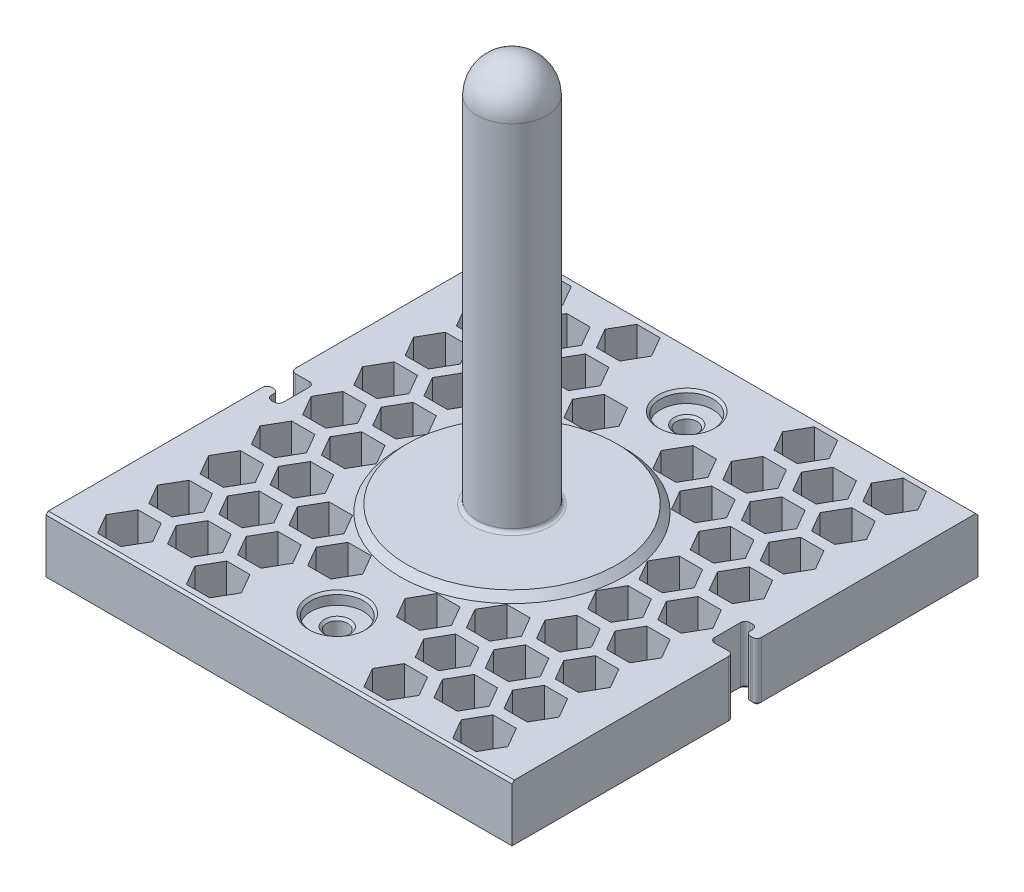
from build123d import *

# Parameters (mm, degrees)
SKETCH1_W           = 200
SKETCH1_H           = 200
BOSS_EXTRUDE1_DEPTH = 25
SKETCH2_R           = 15
BOSS_EXTRUDE2_DEPTH = 170
CUT_EXTRUDE3_REACH  = 242.884
FILLET2_R           = 2
FILLET3_R           = 15
SKETCH4_R           = 45
BOSS_EXTRUDE3_DEPTH = 3
CHAMFER1_SIZE       = 3
FILLET4_R           = 1.5
SKETCH5_R           = 4.5
CUT_EXTRUDE4_DEPTH  = 222.133443875
SKETCH8_R           = 11.25
CUT_EXTRUDE6_DEPTH  = 5
CHAMFER3_SIZE       = 1
FILL_PATTERN1_DEPTH = 25
CHAMFER4_SIZE       = 1


# Read off the part's stored shape, not the designer's step: Fill Pattern1
with BuildPart() as part:
    # Sketch1 → Boss-Extrude1 (new body)
    with BuildSketch(Plane(origin=(0, 0, 0), x_dir=(1, 0, 0), z_dir=(0, 1, 0))):
        Rectangle(SKETCH1_W, SKETCH1_H)
    extrude(amount=BOSS_EXTRUDE1_DEPTH)

    # Sketch2 → Boss-Extrude2 (add)
    with BuildSketch(Plane(origin=(0, 25, 0), x_dir=(1, 0, 0), z_dir=(0, 1, 0))):
        with Locations(Location((0, 0, 0), (0, 0, 270))):
            Circle(SKETCH2_R)
    extrude(amount=BOSS_EXTRUDE2_DEPTH)

    # Sketch3 → Cut-Extrude3 (cut, up to next)
    with BuildSketch(Plane(origin=(0, 0, 0), x_dir=(1, 0, 0), z_dir=(0, 1, 0)), mode=Mode.PRIVATE) as cut_extrude3_sk1:
        with BuildLine():
            Line((-100, 5.1), (-92, 5.1))
            ThreePointArc((-92, 5.1), (-90.585786438, 4.514213562), (-90, 3.1))
            Line((-90, 3.1), (-90, -8.1))
            ThreePointArc((-90, -8.1), (-90.585786438, -9.514213562), (-92, -10.1))
            Line((-92, -10.1), (-93.2, -10.1))
            ThreePointArc((-93.2, -10.1), (-94.614213562, -9.514213562), (-95.2, -8.1))
            Line((-95.2, -8.1), (-95.2, -7.1))
            ThreePointArc((-95.2, -7.1), (-95.785786438, -5.685786438), (-97.2, -5.1))
            Line((-97.2, -5.1), (-100, -5.1))
            Line((-100, -5.1), (-100, 5.1))
        make_face()
    cut_extrude3_tool1 = extrude(cut_extrude3_sk1.sketch, amount=CUT_EXTRUDE3_REACH, mode=Mode.PRIVATE) & part.part
    # Sketch3 → Cut-Extrude3 (cut, up to next)
    with BuildSketch(Plane(origin=(0, 0, 0), x_dir=(1, 0, 0), z_dir=(0, 1, 0)), mode=Mode.PRIVATE) as cut_extrude3_sk2:
        with BuildLine():
            Line((100, -5.1), (92, -5.1))
            ThreePointArc((92, -5.1), (90.585786438, -4.514213562), (90, -3.1))
            Line((90, -3.1), (90, 8.1))
            ThreePointArc((90, 8.1), (90.585786438, 9.514213562), (92, 10.1))
            Line((92, 10.1), (93.2, 10.1))
            ThreePointArc((93.2, 10.1), (94.614213562, 9.514213562), (95.2, 8.1))
            Line((95.2, 8.1), (95.2, 7.1))
            ThreePointArc((95.2, 7.1), (95.785786438, 5.685786438), (97.2, 5.1))
            Line((97.2, 5.1), (100, 5.1))
            Line((100, 5.1), (100, -5.1))
        make_face()
    cut_extrude3_tool2 = extrude(cut_extrude3_sk2.sketch, amount=CUT_EXTRUDE3_REACH, mode=Mode.PRIVATE) & part.part
    add(cut_extrude3_tool1.solids().sort_by_distance((-94.573847, 0, 1.502836))[0], mode=Mode.SUBTRACT)
    add(cut_extrude3_tool2.solids().sort_by_distance((94.573847, 0, -1.502836))[0], mode=Mode.SUBTRACT)

    # Fillet2
    fillet2_edges = [part.edges().sort_by_distance(p)[0] for p in [
        (-100, 12.5, -5.1),
        (-100, 12.5, 5.1),
        (100, 12.5, 5.1),
        (100, 12.5, -5.1),
    ]]
    fillet(fillet2_edges, radius=FILLET2_R)

    # Fillet3
    fillet3_edges = [part.edges().sort_by_distance(p)[0] for p in [
        (0, 195, -15),
    ]]
    fillet(fillet3_edges, radius=FILLET3_R)

    # Sketch4 → Boss-Extrude3 (add)
    with BuildSketch(Plane(origin=(0, 25, 0), x_dir=(1, 0, 0), z_dir=(0, 1, 0))):
        with Locations(Location((0, 0, 0), (0, 0, 270))):
            Circle(SKETCH4_R)
    extrude(amount=BOSS_EXTRUDE3_DEPTH)

    # Chamfer1
    chamfer1_edges = [part.edges().sort_by_distance(p)[0] for p in [
        (0, 25, -45),
    ]]
    chamfer(chamfer1_edges, length=CHAMFER1_SIZE - 0.0001)  # a hair under: the kernel refuses the full size

    # Fillet4
    fillet4_edges = [part.edges().sort_by_distance(p)[0] for p in [
        (0, 28, -15),
    ]]
    fillet(fillet4_edges, radius=FILLET4_R)

    # Sketch5 → Cut-Extrude4 (cut, through all)
    with BuildSketch(Plane(origin=(0, 25, 0), x_dir=(1, 0, 0), z_dir=(0, 1, 0))):
        with Locations(Location((0, 75, 0), (0, 0, 270))):
            Circle(SKETCH5_R)
        with Locations(Location((0, -75, 0), (0, 0, 90))):
            Circle(SKETCH5_R)
    extrude(amount=-CUT_EXTRUDE4_DEPTH, mode=Mode.SUBTRACT)

    # Sketch8 → Cut-Extrude6 (cut)
    with BuildSketch(Plane(origin=(0, 25, 0), x_dir=(1, 0, 0), z_dir=(0, 1, 0))):
        with Locations(Location((0, 75, 0), (0, 0, 270))):
            Circle(SKETCH8_R)
        with Locations(Location((0, -75, 0), (0, 0, 90))):
            Circle(SKETCH8_R)
    extrude(amount=-CUT_EXTRUDE6_DEPTH, mode=Mode.SUBTRACT)

    # Chamfer3
    chamfer3_edges = [part.edges().sort_by_distance(p)[0] for p in [
        (0, 25, -86.25),
        (0, 20, -79.5),
        (0, 20, 79.5),
        (0, 25, 86.25),
    ]]
    chamfer(chamfer3_edges, length=CHAMFER3_SIZE)

    # Fill Pattern1 outline → Fill Pattern1 (cut)
    with BuildSketch(Plane(origin=(0, 0, 0), x_dir=(1, 0, 0), z_dir=(0, 1, 0))):
        Polygon((-86.210235533, 88), (-81.210235533, 79.339745962), (-71.210235533, 79.339745962), (-66.210235533, 88), (-71.210235533, 96.660254038), (-81.210235533, 96.660254038), align=None)
        Polygon((-67.15767665, 55), (-62.15767665, 46.339745962), (-52.15767665, 46.339745962), (-47.15767665, 55), (-52.15767665, 63.660254038), (-62.15767665, 63.660254038), align=None)
        Polygon((-43.105117767, 79.339745962), (-33.105117767, 79.339745962), (-28.105117767, 88), (-33.105117767, 96.660254038), (-43.105117767, 96.660254038), (-48.105117767, 88), align=None)
        Polygon((33.105117767, 79.339745962), (43.105117767, 79.339745962), (48.105117767, 88), (43.105117767, 96.660254038), (33.105117767, 96.660254038), (28.105117767, 88), align=None)
        Polygon((71.210235533, 79.339745962), (81.210235533, 79.339745962), (86.210235533, 88), (81.210235533, 96.660254038), (71.210235533, 96.660254038), (66.210235533, 88), align=None)
        Polygon((-86.210235533, -22), (-81.210235533, -30.660254038), (-71.210235533, -30.660254038), (-66.210235533, -22), (-71.210235533, -13.339745962), (-81.210235533, -13.339745962), align=None)
        Polygon((-48.105117767, -88), (-43.105117767, -96.660254038), (-33.105117767, -96.660254038), (-28.105117767, -88), (-33.105117767, -79.339745962), (-43.105117767, -79.339745962), align=None)
        Polygon((-67.15767665, -55), (-62.15767665, -63.660254038), (-52.15767665, -63.660254038), (-47.15767665, -55), (-52.15767665, -46.339745962), (-62.15767665, -46.339745962), align=None)
        Polygon((71.210235533, -30.660254038), (81.210235533, -30.660254038), (86.210235533, -22), (81.210235533, -13.339745962), (71.210235533, -13.339745962), (66.210235533, -22), align=None)
        Polygon((-52.15767665, 2.339745962), (-47.15767665, 11), (-52.15767665, 19.660254038), (-62.15767665, 19.660254038), (-67.15767665, 11), (-62.15767665, 2.339745962), align=None)
        Polygon((-33.105117767, 35.339745962), (-28.105117767, 44), (-33.105117767, 52.660254038), (-43.105117767, 52.660254038), (-48.105117767, 44), (-43.105117767, 35.339745962), align=None)
        Polygon((-29.052558883, -55), (-24.052558883, -63.660254038), (-14.052558883, -63.660254038), (-9.052558883, -55), (-14.052558883, -46.339745962), (-24.052558883, -46.339745962), align=None)
        Polygon((-86.210235533, 44), (-81.210235533, 35.339745962), (-71.210235533, 35.339745962), (-66.210235533, 44), (-71.210235533, 52.660254038), (-81.210235533, 52.660254038), align=None)
        Polygon((52.15767665, 2.339745962), (62.15767665, 2.339745962), (67.15767665, 11), (62.15767665, 19.660254038), (52.15767665, 19.660254038), (47.15767665, 11), align=None)
        Polygon((-86.210235533, 22), (-81.210235533, 13.339745962), (-71.210235533, 13.339745962), (-66.210235533, 22), (-71.210235533, 30.660254038), (-81.210235533, 30.660254038), align=None)
        Polygon((-67.15767665, -11), (-62.15767665, -19.660254038), (-52.15767665, -19.660254038), (-47.15767665, -11), (-52.15767665, -2.339745962), (-62.15767665, -2.339745962), align=None)
        Polygon((-48.105117767, -44), (-43.105117767, -52.660254038), (-33.105117767, -52.660254038), (-28.105117767, -44), (-33.105117767, -35.339745962), (-43.105117767, -35.339745962), align=None)
        Polygon((71.210235533, 13.339745962), (81.210235533, 13.339745962), (86.210235533, 22), (81.210235533, 30.660254038), (71.210235533, 30.660254038), (66.210235533, 22), align=None)
        Polygon((9.052558883, -55), (14.052558883, -63.660254038), (24.052558883, -63.660254038), (29.052558883, -55), (24.052558883, -46.339745962), (14.052558883, -46.339745962), align=None)
        Polygon((28.105117767, -88), (33.105117767, -96.660254038), (43.105117767, -96.660254038), (48.105117767, -88), (43.105117767, -79.339745962), (33.105117767, -79.339745962), align=None)
        Polygon((-67.15767665, 77), (-62.15767665, 68.339745962), (-52.15767665, 68.339745962), (-47.15767665, 77), (-52.15767665, 85.660254038), (-62.15767665, 85.660254038), align=None)
        Polygon((52.15767665, -63.660254038), (62.15767665, -63.660254038), (67.15767665, -55), (62.15767665, -46.339745962), (52.15767665, -46.339745962), (47.15767665, -55), align=None)
        Polygon((81.210235533, 35.339745962), (86.210235533, 44), (81.210235533, 52.660254038), (71.210235533, 52.660254038), (66.210235533, 44), (71.210235533, 35.339745962), align=None)
        Polygon((-86.210235533, 0), (-81.210235533, -8.660254038), (-71.210235533, -8.660254038), (-66.210235533, 0), (-71.210235533, 8.660254038), (-81.210235533, 8.660254038), align=None)
        Polygon((-48.105117767, -66), (-43.105117767, -74.660254038), (-33.105117767, -74.660254038), (-28.105117767, -66), (-33.105117767, -57.339745962), (-43.105117767, -57.339745962), align=None)
        Polygon((-67.15767665, -33), (-62.15767665, -41.660254038), (-52.15767665, -41.660254038), (-47.15767665, -33), (-52.15767665, -24.339745962), (-62.15767665, -24.339745962), align=None)
        Polygon((71.210235533, -8.660254038), (81.210235533, -8.660254038), (86.210235533, 0), (81.210235533, 8.660254038), (71.210235533, 8.660254038), (66.210235533, 0), align=None)
        Polygon((-52.15767665, 24.339745962), (-47.15767665, 33), (-52.15767665, 41.660254038), (-62.15767665, 41.660254038), (-67.15767665, 33), (-62.15767665, 24.339745962), align=None)
        Polygon((-33.105117767, 57.339745962), (-28.105117767, 66), (-33.105117767, 74.660254038), (-43.105117767, 74.660254038), (-48.105117767, 66), (-43.105117767, 57.339745962), align=None)
        Polygon((-81.210235533, -96.660254038), (-71.210235533, -96.660254038), (-66.210235533, -88), (-71.210235533, -79.339745962), (-81.210235533, -79.339745962), (-86.210235533, -88), align=None)
        Polygon((71.210235533, -96.660254038), (81.210235533, -96.660254038), (86.210235533, -88), (81.210235533, -79.339745962), (71.210235533, -79.339745962), (66.210235533, -88), align=None)
        Polygon((62.15767665, 68.339745962), (67.15767665, 77), (62.15767665, 85.660254038), (52.15767665, 85.660254038), (47.15767665, 77), (52.15767665, 68.339745962), align=None)
        Polygon((43.105117767, 35.339745962), (48.105117767, 44), (43.105117767, 52.660254038), (33.105117767, 52.660254038), (28.105117767, 44), (33.105117767, 35.339745962), align=None)
        Polygon((-86.210235533, -66), (-81.210235533, -74.660254038), (-71.210235533, -74.660254038), (-66.210235533, -66), (-71.210235533, -57.339745962), (-81.210235533, -57.339745962), align=None)
        Polygon((33.105117767, -74.660254038), (43.105117767, -74.660254038), (48.105117767, -66), (43.105117767, -57.339745962), (33.105117767, -57.339745962), (28.105117767, -66), align=None)
        Polygon((71.210235533, -74.660254038), (81.210235533, -74.660254038), (86.210235533, -66), (81.210235533, -57.339745962), (71.210235533, -57.339745962), (66.210235533, -66), align=None)
        Polygon((-67.15767665, -77), (-62.15767665, -85.660254038), (-52.15767665, -85.660254038), (-47.15767665, -77), (-52.15767665, -68.339745962), (-62.15767665, -68.339745962), align=None)
        Polygon((-86.210235533, -44), (-81.210235533, -52.660254038), (-71.210235533, -52.660254038), (-66.210235533, -44), (-71.210235533, -35.339745962), (-81.210235533, -35.339745962), align=None)
        Polygon((52.15767665, -85.660254038), (62.15767665, -85.660254038), (67.15767665, -77), (62.15767665, -68.339745962), (52.15767665, -68.339745962), (47.15767665, -77), align=None)
        Polygon((24.052558883, 46.339745962), (29.052558883, 55), (24.052558883, 63.660254038), (14.052558883, 63.660254038), (9.052558883, 55), (14.052558883, 46.339745962), align=None)
        Polygon((62.15767665, -41.660254038), (67.15767665, -33), (62.15767665, -24.339745962), (52.15767665, -24.339745962), (47.15767665, -33), (52.15767665, -41.660254038), align=None)
        Polygon((-86.210235533, 66), (-81.210235533, 57.339745962), (-71.210235533, 57.339745962), (-66.210235533, 66), (-71.210235533, 74.660254038), (-81.210235533, 74.660254038), align=None)
        Polygon((52.15767665, 24.339745962), (62.15767665, 24.339745962), (67.15767665, 33), (62.15767665, 41.660254038), (52.15767665, 41.660254038), (47.15767665, 33), align=None)
        Polygon((66.210235533, -44), (71.210235533, -52.660254038), (81.210235533, -52.660254038), (86.210235533, -44), (81.210235533, -35.339745962), (71.210235533, -35.339745962), align=None)
        Polygon((47.15767665, -11), (52.15767665, -19.660254038), (62.15767665, -19.660254038), (67.15767665, -11), (62.15767665, -2.339745962), (52.15767665, -2.339745962), align=None)
        Polygon((-24.052558883, 46.339745962), (-14.052558883, 46.339745962), (-9.052558883, 55), (-14.052558883, 63.660254038), (-24.052558883, 63.660254038), (-29.052558883, 55), align=None)
        Polygon((52.15767665, 46.339745962), (62.15767665, 46.339745962), (67.15767665, 55), (62.15767665, 63.660254038), (52.15767665, 63.660254038), (47.15767665, 55), align=None)
        Polygon((43.105117767, 57.339745962), (48.105117767, 66), (43.105117767, 74.660254038), (33.105117767, 74.660254038), (28.105117767, 66), (33.105117767, 57.339745962), align=None)
        Polygon((33.105117767, -52.660254038), (43.105117767, -52.660254038), (48.105117767, -44), (43.105117767, -35.339745962), (33.105117767, -35.339745962), (28.105117767, -44), align=None)
        Polygon((71.210235533, 57.339745962), (81.210235533, 57.339745962), (86.210235533, 66), (81.210235533, 74.660254038), (71.210235533, 74.660254038), (66.210235533, 66), align=None)
    extrude(amount=FILL_PATTERN1_DEPTH, mode=Mode.SUBTRACT)

    # Chamfer4
    chamfer4_edges = [part.edges().sort_by_distance(p)[0] for p in [
        (0, 25, 100),
        (-95.785786438, 0, 5.685786438),
        (-95.2, 0, 7.6),
        (-94.614213562, 0, 9.514213562),
        (-92.6, 0, 10.1),
        (-90.585786438, 0, 9.514213562),
        (-90, 0, 2.5),
        (-90.585786438, 0, -4.514213562),
        (-95, 0, -5.1),
        (95.785786438, 0, -5.685786438),
        (0, 0, 100),
        (95.2, 0, -7.6),
        (94.614213562, 0, -9.514213562),
        (92.6, 0, -10.1),
        (90.585786438, 0, -9.514213562),
        (90, 0, -2.5),
        (90.585786438, 0, 4.514213562),
        (95, 0, 5.1),
        (-100, 0, -53.55),
        (0, 0, -100),
        (100, 0, 53.55),
        (-97.6, 0, 5.1),
        (100, 0, -53.55),
        (97.6, 0, -5.1),
        (-100, 0, 53.55),
        (-99.414213562, 0, -5.685786438),
        (-99.414213562, 0, 5.685786438),
        (99.414213562, 0, -5.685786438),
        (99.414213562, 0, 5.685786438),
        (0, 25, -100),
    ]]
    chamfer(chamfer4_edges, length=CHAMFER4_SIZE)


solid = part.part
